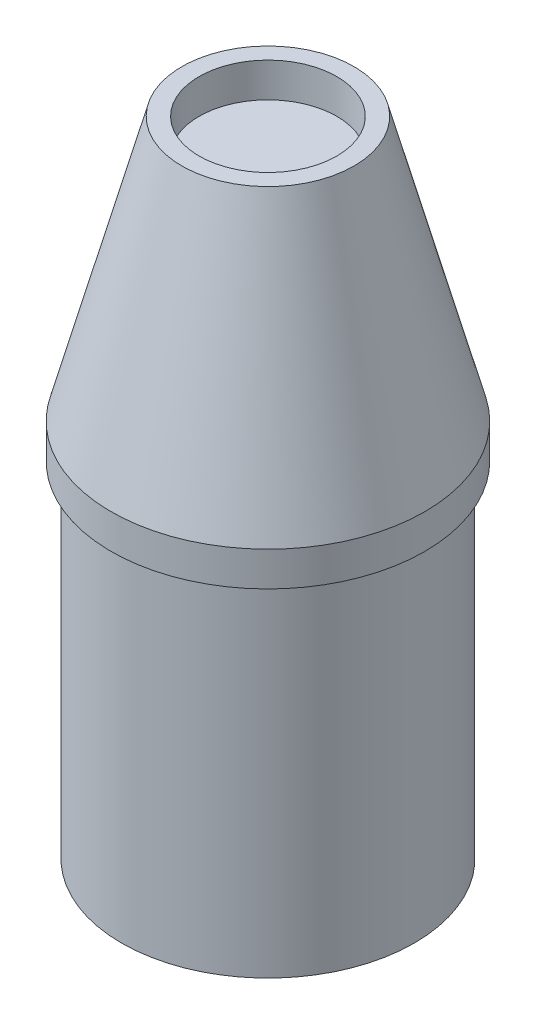
from build123d import *


with BuildPart() as part:
    # Sketch1 → Revolve1 (revolve)
    with BuildSketch(Plane.XY):
        Polygon((0, -26.474725563), (0, 85.702039915), (12.7, 85.702039915), (12.7, 92.052039915), (15.875, 92.052039915), (28.9179, 43.375274437), (28.9179, 37.025274437), (26.9875, 37.025274437), (26.9875, -26.474725563), align=None)
    revolve(axis=Axis((0, -26.474725563, 0), (0, 1, 0)))


solid = part.part
